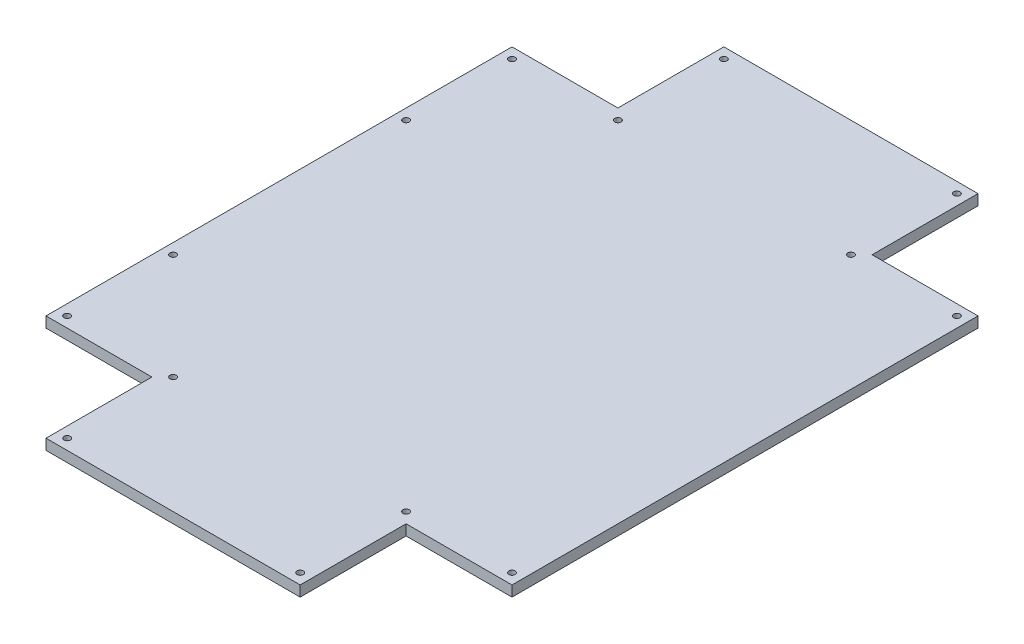
from build123d import *

# Parameters (mm, degrees)
ESQUISSE1_R        = 1.5
BOSS_EXTRU_1_DEPTH = 5


with BuildPart() as part:
    # Esquisse1 → Boss.-Extru.1 (new body)
    with BuildSketch(Plane(origin=(0, 0, 0), x_dir=(1, 0, 0), z_dir=(0, 1, 0))):
        Polygon((-60, 110), (-60, 160), (60, 160), (60, 110), (110, 110), (110, -110), (60, -110), (60, -160), (-60, -160), (-60, -110), (-110, -110), (-110, 0), (-110, 110), align=None)
        with Locations((-105, -105)):
            Circle(ESQUISSE1_R, mode=Mode.SUBTRACT)
        with Locations((-105, -55)):
            Circle(ESQUISSE1_R, mode=Mode.SUBTRACT)
        with Locations((-55, -105)):
            Circle(ESQUISSE1_R, mode=Mode.SUBTRACT)
        with Locations((-55, -155)):
            Circle(ESQUISSE1_R, mode=Mode.SUBTRACT)
        with Locations((-55, 155)):
            Circle(ESQUISSE1_R, mode=Mode.SUBTRACT)
        with Locations((-55, 105)):
            Circle(ESQUISSE1_R, mode=Mode.SUBTRACT)
        with Locations((-105, 105)):
            Circle(ESQUISSE1_R, mode=Mode.SUBTRACT)
        with Locations((-105, 55)):
            Circle(ESQUISSE1_R, mode=Mode.SUBTRACT)
        with Locations((55, -155)):
            Circle(ESQUISSE1_R, mode=Mode.SUBTRACT)
        with Locations((55, -105)):
            Circle(ESQUISSE1_R, mode=Mode.SUBTRACT)
        with Locations((105, -105)):
            Circle(ESQUISSE1_R, mode=Mode.SUBTRACT)
        with Locations((105, 105)):
            Circle(ESQUISSE1_R, mode=Mode.SUBTRACT)
        with Locations((55, 105)):
            Circle(ESQUISSE1_R, mode=Mode.SUBTRACT)
        with Locations((55, 155)):
            Circle(ESQUISSE1_R, mode=Mode.SUBTRACT)
    extrude(amount=BOSS_EXTRU_1_DEPTH)


solid = part.part
